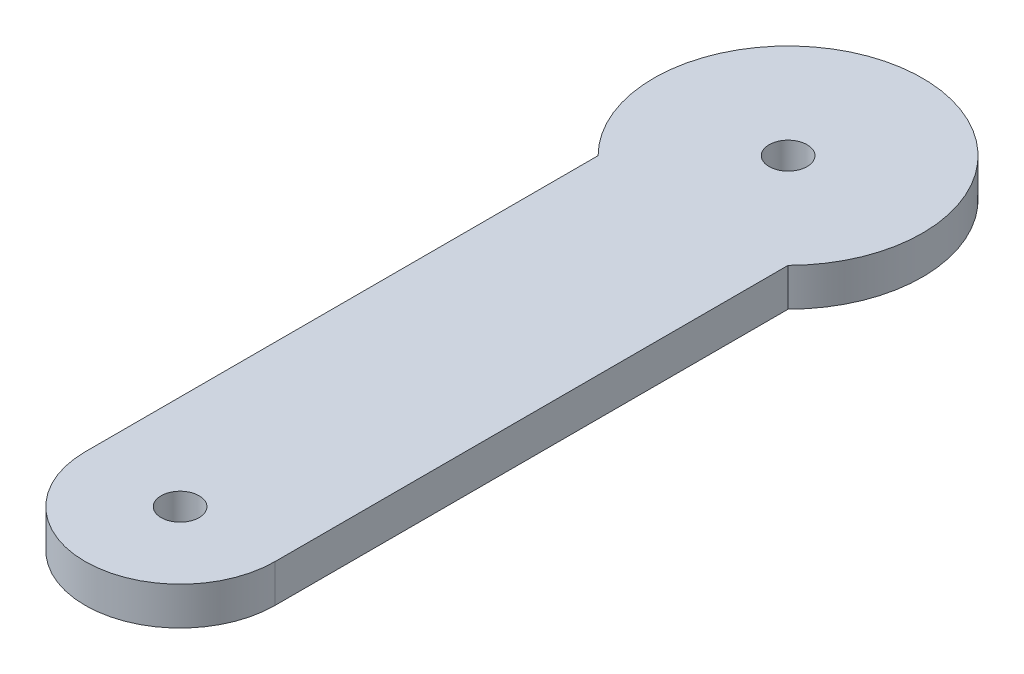
from build123d import *

# Parameters (mm, degrees)
SKETCH1_R           = 2.5
BOSS_EXTRUDE1_DEPTH = 5


with BuildPart() as part:
    # Sketch1 → Boss-Extrude1 (new body)
    with BuildSketch(Plane(origin=(0, 0, 0), x_dir=(1, 0, 0), z_dir=(0, 1, 0))):
        with BuildLine():
            Line((-12.5, 67.5), (-12.5, 0))
            ThreePointArc((-12.5, 0), (0, -12.5), (12.5, 0))
            Line((12.5, 0), (12.5, 67.5))
            ThreePointArc((12.5, 67.5), (0, 97.67766953), (-12.5, 67.5))
        make_face()
        Circle(SKETCH1_R, mode=Mode.SUBTRACT)
        with Locations((0, 80)):
            Circle(SKETCH1_R, mode=Mode.SUBTRACT)
    extrude(amount=BOSS_EXTRUDE1_DEPTH)


solid = part.part
